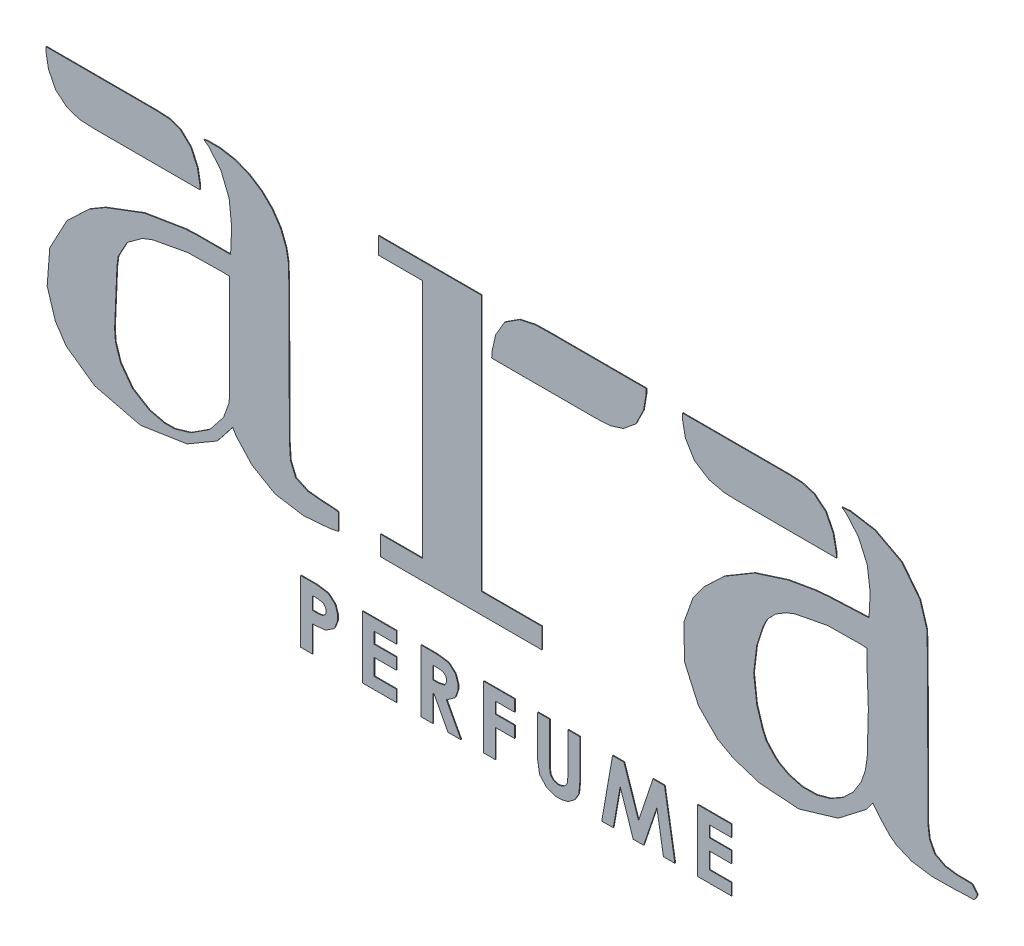
from build123d import *

# Parameters (mm, degrees)
BOSS_EXTRUDE1_DEPTH    = 1
BOSS_EXTRUDE1_2_DEPTH  = 1
BOSS_EXTRUDE1_3_DEPTH  = 1
BOSS_EXTRUDE1_4_DEPTH  = 1
BOSS_EXTRUDE1_5_DEPTH  = 1
BOSS_EXTRUDE1_6_DEPTH  = 1
BOSS_EXTRUDE1_7_DEPTH  = 1
BOSS_EXTRUDE1_8_DEPTH  = 1
BOSS_EXTRUDE1_9_DEPTH  = 1
BOSS_EXTRUDE1_10_DEPTH = 1
BOSS_EXTRUDE1_11_DEPTH = 1
BOSS_EXTRUDE1_12_DEPTH = 1
BOSS_EXTRUDE1_13_DEPTH = 1


with BuildPart() as part:
    # Model → Boss-Extrude1 (new body)
    with BuildSketch(Plane.XY):
        Polygon((1543.31162, 1669.36166), (1552.41752, 1681.78988), (1554.76448, 1679.16352), (1565.54424, 1665.85646), (1576.67198, 1654.1369), (1579.22722, 1652.2446), (1585.04128, 1647.97232), (1605.6229, 1639.2525), (1633.48162, 1634.95228), (1662.1125, 1635.22914), (1683.64408, 1636.10798), (1690.81196, 1636.0013), (1691.26916, 1636.0013), (1694.27906, 1639.2525), (1696.0977, 1643.76862), (1695.99102, 1644.3706), (1695.82084, 1645.23928), (1689.48608, 1652.87198), (1688.71646, 1653.11582), (1687.52266, 1653.49936), (1674.50262, 1653.71526), (1673.20468, 1653.71526), (1667.74876, 1653.78638), (1651.43942, 1656.0546), (1637.72088, 1663.5095), (1630.50728, 1677.55062), (1628.40162, 1694.07332), (1628.40162, 1699.56734), (1628.37368, 1717.48704), (1627.60406, 1896.59006), (1627.14686, 1914.47674), (1626.87, 1924.90598), (1617.345, 1955.9905), (1592.46062, 1987.8802), (1555.63316, 2007.54996), (1521.29744, 2013.18622), (1510.06048, 2012.3785), (1516.57304, 2007.44328), (1532.9535, 1988.36534), (1545.03374, 1961.16956), (1548.87676, 1931.3144), (1548.00808, 1907.2987), (1547.12924, 1899.3612), (1541.95018, 1899.10974), (1491.30512, 1896.80596), (1486.3318, 1896.34876), (1473.80452, 1895.22862), (1436.4589, 1888.82274), (1390.11406, 1873.98406), (1348.49108, 1849.30542), (1320.38344, 1822.53128), (1312.9006, 1812.23666), (1305.85718, 1802.64816), (1293.29434, 1767.57584), (1293.92172, 1720.49948), (1313.31208, 1677.55062), (1339.56806, 1651.0889), (1350.03286, 1645.3104), (1360.88374, 1639.32362), (1397.04064, 1627.60406), (1451.08168, 1623.822), (1505.19384, 1639.9256), align=None)
        Polygon((1535.65098, 1862.32546), (1544.57654, 1861.66252), (1544.57654, 1843.87744), (1546.50186, 1790.49934), (1544.96008, 1732.36128), (1543.21256, 1720.95414), (1542.37182, 1715.4906), (1536.9413, 1699.53178), (1526.06248, 1681.6451), (1511.5032, 1667.63954), (1494.35312, 1657.88086), (1475.5876, 1652.69418), (1456.19724, 1652.41732), (1437.25392, 1657.4262), (1423.68016, 1664.77188), (1419.79142, 1667.96212), (1418.42998, 1669.08226), (1406.34974, 1682.3436), (1405.65124, 1683.88538), (1401.66344, 1692.31818), (1393.18746, 1719.16344), (1389.02948, 1754.55834), (1393.29414, 1789.7983), (1401.9784, 1816.43782), (1406.03732, 1824.736), (1407.37082, 1827.46142), (1418.9837, 1839.6458), (1433.8681, 1848.64248), (1436.87038, 1849.76262), (1445.62322, 1853.1586), (1490.49994, 1861.76158), align=None, mode=Mode.SUBTRACT)
    extrude(amount=BOSS_EXTRUDE1_DEPTH)


with BuildPart() as body_2:
    # Model → Boss-Extrude1 2 (new body)
    with BuildSketch(Plane.XY):
        Polygon((671.1315, 1901.56338), (670.50158, 1893.0239), (659.02078, 1893.0239), (624.57838, 1893.062), (620.55248, 1892.88166), (608.82784, 1892.3889), (552.05376, 1883.11536), (498.25656, 1862.81822), (488.07116, 1856.79842), (476.31096, 1849.86168), (445.85636, 1820.99204), (422.26738, 1776.99416), (418.69614, 1729.62824), (429.82642, 1693.72534), (436.5117, 1683.70504), (444.73622, 1671.32254), (483.83444, 1643.59844), (546.76802, 1628.0892), (610.75316, 1637.89106), (652.08912, 1662.00328), (661.3652, 1673.59076), (662.34564, 1674.85314), (672.35832, 1687.703), (673.40734, 1689.02888), (678.83278, 1680.41828), (699.76492, 1657.49732), (731.75622, 1638.84102), (770.88746, 1632.50626), (806.97578, 1635.40948), (818.70042, 1637.8555), (818.70042, 1660.88314), (817.47614, 1661.02792), (807.29074, 1662.03884), (806.34586, 1662.03884), (798.85286, 1662.2903), (776.52372, 1664.49502), (760.00102, 1672.19122), (752.89664, 1689.20922), (751.3574, 1711.99556), (751.3574, 1719.54952), (751.28628, 1736.1789), (750.51666, 1902.33554), (749.95532, 1918.92174), (749.7826, 1924.13636), (746.80572, 1939.6837), (739.21112, 1958.72354), (727.80144, 1975.59676), (713.13294, 1989.80806), (695.84316, 2000.9739), (676.4528, 2008.59898), (655.55622, 2012.23626), (639.1402, 2012.20832), (633.8189, 2011.4387), (640.50418, 2006.5365), (657.09546, 1987.03946), (668.64738, 1958.7591), (671.93668, 1927.25548), align=None)
        Polygon((659.61514, 1866.80602), (669.2773, 1866.34882), (669.2773, 1734.53044), (668.89122, 1722.81088), (668.61182, 1715.73952), (661.01468, 1694.77182), (642.11454, 1670.7231), (616.10748, 1653.84988), (594.16188, 1647.34494), (586.84668, 1647.23572), (579.95058, 1647.1646), (559.15814, 1652.03124), (535.98826, 1666.2781), (519.4681, 1688.53612), (512.4323, 1710.0677), (511.90652, 1717.3448), (511.31216, 1724.87082), (514.53288, 1800.7584), (515.51332, 1808.24886), (516.17626, 1813.70732), (528.3581, 1836.1787), (549.46296, 1851.65492), (554.64456, 1853.60818), (563.92064, 1857.1464), (611.4542, 1865.96528), align=None, mode=Mode.SUBTRACT)
    extrude(amount=BOSS_EXTRUDE1_2_DEPTH)


with BuildPart() as body_3:
    # Model → Boss-Extrude1 3 (new body)
    with BuildSketch(Plane.XY):
        Polygon((873.72444, 1993.79586), (933.99356, 1993.79586), (933.99356, 1663.41044), (876.41938, 1663.41044), (876.41938, 1636.56518), (1098.19694, 1636.56518), (1098.19694, 1664.56614), (1014.98908, 1664.56614), (1014.98908, 2016.93018), (873.72444, 2016.93018), align=None)
    extrude(amount=BOSS_EXTRUDE1_3_DEPTH)


with BuildPart() as body_4:
    # Model → Boss-Extrude1 4 (new body)
    with BuildSketch(Plane.XY):
        Polygon((1029.58646, 1956.79822), (1029.20038, 1949.16298), (1065.149, 1949.16298), (1173.06344, 1949.19854), (1186.00982, 1949.86148), (1192.03216, 1950.18406), (1209.88074, 1955.78476), (1227.21116, 1969.9605), (1237.74962, 1991.37524), (1241.27768, 2012.1372), (1241.27768, 2019.02822), (1207.89192, 2019.02822), (1107.74988, 2019.09934), (1095.63408, 2018.82248), (1088.56526, 2018.6777), (1067.42738, 2014.0295), (1047.19374, 2001.00946), (1034.55978, 1979.43978), align=None)
    extrude(amount=BOSS_EXTRUDE1_4_DEPTH)


with BuildPart() as body_5:
    # Model → Boss-Extrude1 5 (new body)
    with BuildSketch(Plane.XY):
        Polygon((1436.87038, 2014.82452), (1291.12518, 2014.82452), (1291.08962, 2007.9716), (1295.18664, 1987.31632), (1307.32784, 1966.9125), (1327.3532, 1953.93056), (1348.10754, 1948.95724), (1355.10524, 1948.67784), (1362.74048, 1948.36542), (1439.21734, 1948.11396), (1446.88814, 1948.0784), (1502.71226, 1948.0784), (1502.32618, 1954.97704), (1498.19614, 1975.41642), (1488.01582, 1995.8558), (1472.01382, 2008.94696), (1455.5343, 2013.95584), (1449.9971, 2014.19968), align=None)
    extrude(amount=BOSS_EXTRUDE1_5_DEPTH)


with BuildPart() as body_6:
    # Model → Boss-Extrude1 6 (new body)
    with BuildSketch(Plane.XY):
        Polygon((458.38872, 2013.49864), (417.08578, 2013.49864), (417.1569, 2007.235), (420.55034, 1988.4009), (430.38776, 1968.66002), (446.52184, 1955.39868), (463.25282, 1950.07738), (468.92464, 1949.76242), (482.1555, 1949.02836), (588.59674, 1948.95724), (628.4976, 1948.95724), (628.3579, 1955.11166), (625.0686, 1973.52666), (616.00334, 1993.40978), (601.65234, 2006.98608), (587.16164, 2012.3785), (582.29754, 2012.62234), (568.5409, 2013.39196), align=None)
    extrude(amount=BOSS_EXTRUDE1_6_DEPTH)


with BuildPart() as body_7:
    # Model → Boss-Extrude1 7 (new body)
    with BuildSketch(Plane.XY):
        Polygon((766.89712, 1559.41522), (766.89712, 1474.04836), (783.0693, 1474.04836), (783.0693, 1510.16716), (787.3746, 1510.16716), (799.48532, 1511.32286), (800.2905, 1511.5032), (801.61892, 1511.88674), (812.22596, 1518.81332), (813.03114, 1519.79122), (813.80076, 1520.8123), (817.68442, 1531.20598), (817.68442, 1538.13256), (814.71008, 1547.55088), (814.11572, 1548.46528), (813.52136, 1549.44064), (805.36542, 1556.40278), (804.34942, 1556.78886), (803.3004, 1557.24606), (788.91384, 1559.41522), align=None)
        Polygon((783.0693, 1526.02692), (783.0693, 1543.59864), (790.27782, 1543.59864), (797.66414, 1542.19148), (798.15436, 1541.91462), (798.78428, 1541.52854), (801.96944, 1536.38504), (801.96944, 1533.48182), (800.74516, 1530.1595), (800.32352, 1529.45846), (797.24504, 1527.00482), (796.85896, 1526.83464), (796.43986, 1526.68986), (790.31338, 1526.02692), align=None, mode=Mode.SUBTRACT)
    extrude(amount=BOSS_EXTRUDE1_7_DEPTH)


with BuildPart() as body_8:
    # Model → Boss-Extrude1 8 (new body)
    with BuildSketch(Plane.XY):
        Polygon((851.56802, 1559.41522), (851.56802, 1474.04836), (898.22274, 1474.04836), (898.22274, 1489.93352), (867.77322, 1489.93352), (867.77322, 1512.443), (898.22274, 1512.443), (898.22274, 1528.12496), (867.77322, 1528.12496), (867.77322, 1543.52752), (898.22274, 1543.52752), (898.22274, 1559.41522), align=None)
    extrude(amount=BOSS_EXTRUDE1_8_DEPTH)


with BuildPart() as body_9:
    # Model → Boss-Extrude1 9 (new body)
    with BuildSketch(Plane.XY):
        Polygon((932.24604, 1559.41522), (932.24604, 1474.04836), (948.42076, 1474.04836), (948.42076, 1510.16716), (950.0616, 1510.16716), (969.21066, 1474.04836), (987.05924, 1474.04836), (966.8256, 1511.95024), (968.1972, 1512.443), (978.31402, 1519.58548), (978.97696, 1520.52528), (979.6399, 1521.47524), (983.03588, 1531.37616), (983.03588, 1538.13256), (979.95232, 1547.47976), (979.32494, 1548.46528), (978.73566, 1549.4762), (970.71434, 1556.54756), (969.70342, 1556.9692), (968.6798, 1557.3883), (954.26276, 1559.41522), align=None)
        Polygon((948.42076, 1526.02692), (948.42076, 1543.59864), (955.17716, 1543.59864), (961.54748, 1542.82902), (961.9615, 1542.64868), (962.34504, 1542.51406), (965.6064, 1540.06042), (965.8858, 1539.67434), (966.09154, 1539.36192), (967.31836, 1535.96594), (967.31836, 1533.13384), (964.83678, 1528.40182), (964.34402, 1528.01574), (963.85126, 1527.70332), (956.0814, 1526.02692), align=None, mode=Mode.SUBTRACT)
    extrude(amount=BOSS_EXTRUDE1_9_DEPTH)


with BuildPart() as body_10:
    # Model → Boss-Extrude1 10 (new body)
    with BuildSketch(Plane.XY):
        Polygon((1018.25044, 1559.41522), (1018.25044, 1474.04836), (1034.415, 1474.04836), (1034.415, 1512.443), (1060.59732, 1512.443), (1060.59732, 1528.12496), (1034.415, 1528.12496), (1034.415, 1543.6977), (1060.59732, 1543.6977), (1060.59732, 1559.41522), align=None)
    extrude(amount=BOSS_EXTRUDE1_10_DEPTH)


with BuildPart() as body_11:
    # Model → Boss-Extrude1 11 (new body)
    with BuildSketch(Plane.XY):
        Polygon((1092.34478, 1559.41522), (1092.34478, 1503.1339), (1094.80096, 1487.9447), (1095.31912, 1486.86012), (1095.77632, 1485.80348), (1104.00338, 1476.87792), (1105.19464, 1476.14386), (1106.31478, 1475.44536), (1117.51618, 1471.91476), (1124.37164, 1471.91476), (1132.84762, 1473.76896), (1133.75186, 1474.15504), (1134.6307, 1474.54112), (1142.43612, 1480.23834), (1143.13462, 1481.0105), (1143.79756, 1481.81568), (1148.49148, 1489.87256), (1148.73532, 1490.67012), (1148.94868, 1491.51086), (1150.16788, 1504.2896), (1150.16788, 1559.41522), (1133.85854, 1559.41522), (1133.85854, 1503.3752), (1132.88318, 1495.14814), (1132.66728, 1494.62998), (1132.46154, 1494.13722), (1128.88776, 1489.93352), (1128.40262, 1489.58554), (1127.83874, 1489.27058), (1122.69524, 1487.59672), (1119.2637, 1487.59672), (1114.46818, 1489.1004), (1114.01098, 1489.3798), (1113.52838, 1489.69222), (1110.16796, 1493.61652), (1109.95206, 1494.10166), (1109.74632, 1494.59442), (1108.66174, 1501.83342), (1108.66174, 1559.41522), align=None)
    extrude(amount=BOSS_EXTRUDE1_11_DEPTH)


with BuildPart() as body_12:
    # Model → Boss-Extrude1 12 (new body)
    with BuildSketch(Plane.XY):
        Polygon((1195.14874, 1559.41522), (1180.37356, 1474.04836), (1196.19776, 1474.04836), (1205.61608, 1527.91922), (1223.57388, 1474.04836), (1237.8563, 1474.04836), (1256.0554, 1527.91922), (1265.08764, 1474.04836), (1280.80516, 1474.04836), (1266.5202, 1559.41522), (1250.696, 1559.41522), (1230.81288, 1499.8446), (1210.8307, 1559.41522), align=None)
    extrude(amount=BOSS_EXTRUDE1_12_DEPTH)


with BuildPart() as body_13:
    # Model → Boss-Extrude1 13 (new body)
    with BuildSketch(Plane.XY):
        Polygon((1311.95064, 1559.41522), (1311.95064, 1474.04836), (1358.57234, 1474.04836), (1358.57234, 1489.93352), (1328.12536, 1489.93352), (1328.12536, 1512.443), (1358.57234, 1512.443), (1358.57234, 1528.12496), (1328.12536, 1528.12496), (1328.12536, 1543.52752), (1358.57234, 1543.52752), (1358.57234, 1559.41522), align=None)
    extrude(amount=BOSS_EXTRUDE1_13_DEPTH)


solid = Compound([part.part, body_2.part, body_3.part, body_4.part, body_5.part, body_6.part, body_7.part, body_8.part, body_9.part, body_10.part, body_11.part, body_12.part, body_13.part])
